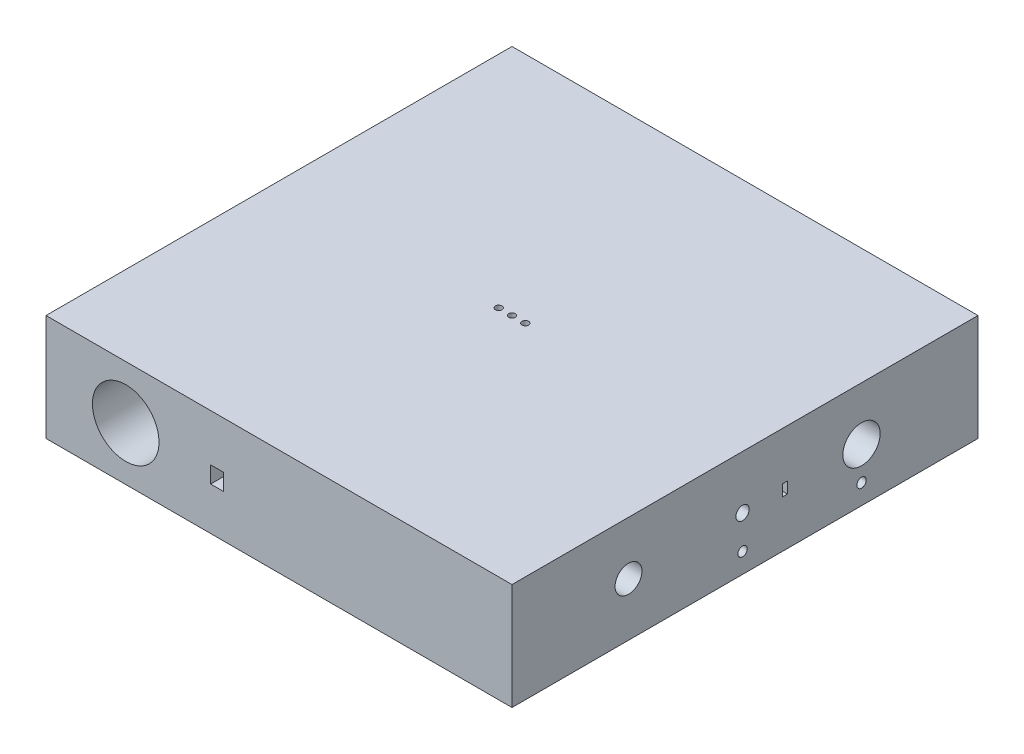
from build123d import *

# Parameters (mm, degrees)
SKETCH1_W               = 350
SKETCH1_H               = 350
BOSS_EXTRUDE1_DEPTH     = 80
CUT_EXTRUDE1_DEPTH      = 261.096136073
SKETCH2_4_R             = 2.5
CUT_EXTRUDE2_DEPTH      = 261.096136073
SKETCH2_5_R             = 2.5
CUT_EXTRUDE3_DEPTH      = 261.096136073
SKETCH3_W               = 3.7
SKETCH3_H               = 8.5
CUT_EXTRUDE4_DEPTH      = 400.405808671
SKETCH4_R               = 10.1
CUT_EXTRUDE5_DEPTH      = 400.405808671
CUT_EXTRUDE7_DEPTH      = 10
CUT_EXTRUDE7_DEPTH_BACK = 400.405808671
SKETCH6_R               = 3.555
SKETCH7_R               = 3.555
CUT_EXTRUDE8_DEPTH      = 400.405808778
SKETCH9_R               = 14
CUT_EXTRUDE10_DEPTH     = 400.405808778
SKETCH11_R              = 5.025
CUT_EXTRUDE12_DEPTH     = 400.405808778
SKETCH13_R              = 25
CUT_EXTRUDE14_DEPTH     = 400.405808735
SKETCH14_W              = 9.7
SKETCH14_H              = 12.5
CUT_EXTRUDE18_DEPTH     = 400.405808822


with BuildPart() as part:
    # Sketch1 → Boss-Extrude1 (new body)
    with BuildSketch(Plane(origin=(0, 0, 0), x_dir=(1, 0, 0), z_dir=(0, 1, 0))):
        Rectangle(SKETCH1_W, SKETCH1_H)
    extrude(amount=BOSS_EXTRUDE1_DEPTH)

    # Sketch2 → Cut-Extrude1 (cut, through all)
    with BuildSketch(Plane(origin=(0, 80, 0), x_dir=(1, 0, 0), z_dir=(0, 1, 0))):
        with BuildLine():
            ThreePointArc((0, 2.5), (-1.767766953, -1.767766953), (2.5, 0))
            ThreePointArc((2.5, 0), (1.767766953, 1.767766953), (0, 2.5))
        make_face()
    extrude(amount=-CUT_EXTRUDE1_DEPTH, mode=Mode.SUBTRACT)

    # Sketch2<4> → Cut-Extrude2 (cut, through all)
    with BuildSketch(Plane(origin=(0, 80, 0), x_dir=(1, 0, 0), z_dir=(0, 1, 0))):
        with Locations((10, 0)):
            Circle(SKETCH2_4_R)
    extrude(amount=-CUT_EXTRUDE2_DEPTH, mode=Mode.SUBTRACT)

    # Sketch2<5> → Cut-Extrude3 (cut, through all)
    with BuildSketch(Plane(origin=(0, 80, 0), x_dir=(1, 0, 0), z_dir=(0, 1, 0))):
        with Locations((-10, 0)):
            Circle(SKETCH2_5_R)
    extrude(amount=-CUT_EXTRUDE3_DEPTH, mode=Mode.SUBTRACT)

    # Sketch3 → Cut-Extrude4 (cut, through all)
    with BuildSketch(Plane.ZY.offset(175)):
        with Locations((-30, 39.681610839)):
            Rectangle(SKETCH3_W, SKETCH3_H)
    extrude(amount=-CUT_EXTRUDE4_DEPTH, mode=Mode.SUBTRACT)

    # Sketch4 → Cut-Extrude5 (cut, through all)
    with BuildSketch(Plane.ZY.offset(175)):
        with Locations((87.5, 40)):
            Circle(SKETCH4_R)
    extrude(amount=-CUT_EXTRUDE5_DEPTH, mode=Mode.SUBTRACT)

    # Sketch6 → Cut-Extrude7 (cut, two sides: drawn at the far end of the back side and taken through both)
    with BuildSketch(Plane.ZY.offset(175).offset(-CUT_EXTRUDE7_DEPTH_BACK)):
        with Locations((1.85, 15)):
            Circle(SKETCH6_R)
    extrude(amount=CUT_EXTRUDE7_DEPTH + CUT_EXTRUDE7_DEPTH_BACK, mode=Mode.SUBTRACT)

    # Sketch7 → Cut-Extrude8 (cut, through all)
    with BuildSketch(Plane.ZY.offset(175)):
        with Locations((-87.5, 15)):
            Circle(SKETCH7_R)
    extrude(amount=-CUT_EXTRUDE8_DEPTH, mode=Mode.SUBTRACT)

    # Sketch9 → Cut-Extrude10 (cut, through all)
    with BuildSketch(Plane.ZY.offset(175)):
        with Locations((-87.5, 40)):
            Circle(SKETCH9_R)
    extrude(amount=-CUT_EXTRUDE10_DEPTH, mode=Mode.SUBTRACT)

    # Sketch11 → Cut-Extrude12 (cut, through all)
    with BuildSketch(Plane.ZY.offset(175)):
        with Locations((1.85, 40)):
            Circle(SKETCH11_R)
    extrude(amount=-CUT_EXTRUDE12_DEPTH, mode=Mode.SUBTRACT)

    # Sketch13 → Cut-Extrude14 (cut, through all)
    with BuildSketch(Plane(origin=(0, 0, -175), x_dir=(-1, 0, 0), z_dir=(0, 0, -1))):
        with Locations((115.112005789, 40)):
            Circle(SKETCH13_R)
    extrude(amount=-CUT_EXTRUDE14_DEPTH, mode=Mode.SUBTRACT)

    # Sketch14 → Cut-Extrude18 (cut, through all)
    with BuildSketch(Plane(origin=(0, 0, -175), x_dir=(-1, 0, 0), z_dir=(0, 0, -1))):
        with Locations((46.47975887, 38.444138081)):
            Rectangle(SKETCH14_W, SKETCH14_H)
    extrude(amount=-CUT_EXTRUDE18_DEPTH, mode=Mode.SUBTRACT)


solid = part.part
